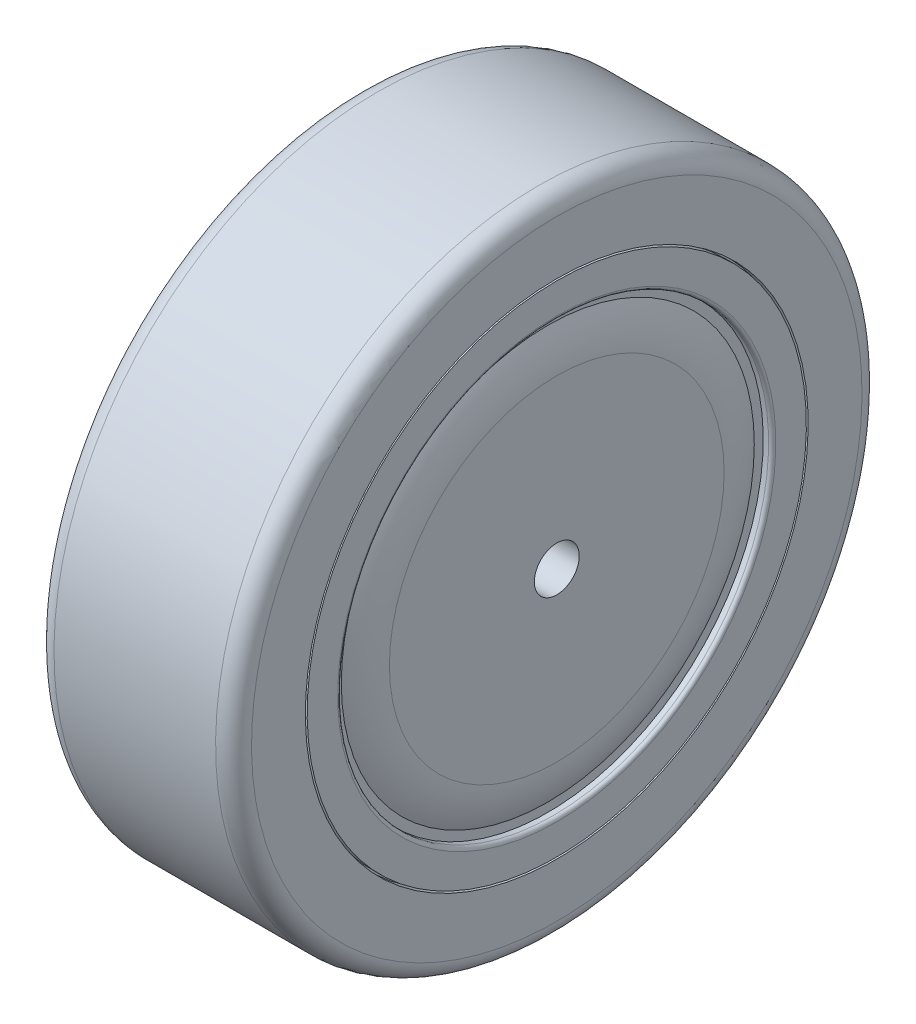
from build123d import *

# Parameters (mm, degrees)
ENL_V_MAT_EXTRU_1_DEPTH      = 53.086466642
ENL_V_MAT_EXTRU_1_DEPTH_BACK = 53.086466642
ESQUISSE2_R                  = 2.5
FILLET1_R                    = 10
FILLET2_R                    = 0.4


with BuildPart() as part:
    # Esquisse1 → Révolution1 (revolve)
    with BuildSketch(Plane.XY, mode=Mode.PRIVATE) as r_volution1_sk:
        with BuildLine():
            Line((9, -36), (-9, -36))
            ThreePointArc((-9, -36), (-10.414213562, -35.414213562), (-11, -34))
            Line((-11, -34), (-11, -28))
            Line((-11, -28), (-10, -28))
            Line((-10, -28), (-10, -27.8))
            Line((-10, -27.8), (-11, -27.8))
            Line((-11, -27.8), (-11, -24))
            Line((-11, -24), (-10, -24))
            Line((-10, -24), (-10, -23))
            Line((-10, -23), (-11, -23))
            Line((-11, -23), (-11, 0))
            Line((-11, 0), (11, 0))
            Line((11, 0), (11, -23))
            Line((11, -23), (10, -23))
            Line((10, -23), (10, -24))
            Line((10, -24), (11, -24))
            Line((11, -24), (11, -27.8))
            Line((11, -27.8), (10, -27.8))
            Line((10, -27.8), (10, -28))
            Line((10, -28), (11, -28))
            Line((11, -28), (11, -34))
            ThreePointArc((11, -34), (10.414213562, -35.414213562), (9, -36))
        make_face()
    revolve(r_volution1_sk.sketch.rotate(Axis((11, 0, 0), (-1, 0, 0)), 180), axis=Axis((11, 0, 0), (-1, 0, 0)))

    # Esquisse2 → Enlèv. mat.-Extru.1 (cut, two sides: drawn at the far end of the back side and taken through both)
    with BuildSketch(Plane.ZY.offset(-ENL_V_MAT_EXTRU_1_DEPTH_BACK)):
        Circle(ESQUISSE2_R)
    extrude(amount=ENL_V_MAT_EXTRU_1_DEPTH + ENL_V_MAT_EXTRU_1_DEPTH_BACK, mode=Mode.SUBTRACT)

    # Fillet1
    # the kernel refuses this fillet: 10 mm, written as the material it takes off along each edge
    with BuildSketch(Plane(origin=(11, 0, 0), x_dir=(0, 1, 0), z_dir=(0, 0, 1))) as fillet1_piece_1:
        with BuildLine():
            CenterArc((18.641101056, 10), FILLET1_R, 270, 25.841932763)
            Line((23, 1), (23.087177979, 0.82))
            ThreePointArc((23.087177979, 0.82), (23.2, 0.5), (23.2, 0))
            Line((23.2, 0), (23, -0.2))
            Line((23, -0.2), (18.641101056, -0.2))
            Line((18.641101056, -0.2), (18.641101056, 0))
        make_face()
    revolve(axis=Axis((11, 0, 0), (-1, 0, 0)), mode=Mode.SUBTRACT)
    with BuildSketch(Plane(origin=(-11, 0, 0), x_dir=(0, 1, 0), z_dir=(0, 0, 1))) as fillet1_piece_2:
        with BuildLine():
            CenterArc((18.641101056, -10), FILLET1_R, 64.158067237, 25.841932763)
            Line((18.641101056, 0), (18.641101056, 0.2))
            Line((18.641101056, 0.2), (23, 0.2))
            Line((23, 0.2), (23.2, 0))
            ThreePointArc((23.2, 0), (23.2, -0.5), (23.087177979, -0.82))
            Line((23.087177979, -0.82), (23, -1))
        make_face()
    revolve(axis=Axis((-11, 0, 0), (-1, 0, 0)), mode=Mode.SUBTRACT)

    # Fillet2
    fillet2_edges = [part.edges().sort_by_distance(p)[0] for p in [
        (11, -24, 0),
        (-11, -24, 0),
    ]]
    fillet(fillet2_edges, radius=FILLET2_R)


solid = part.part
